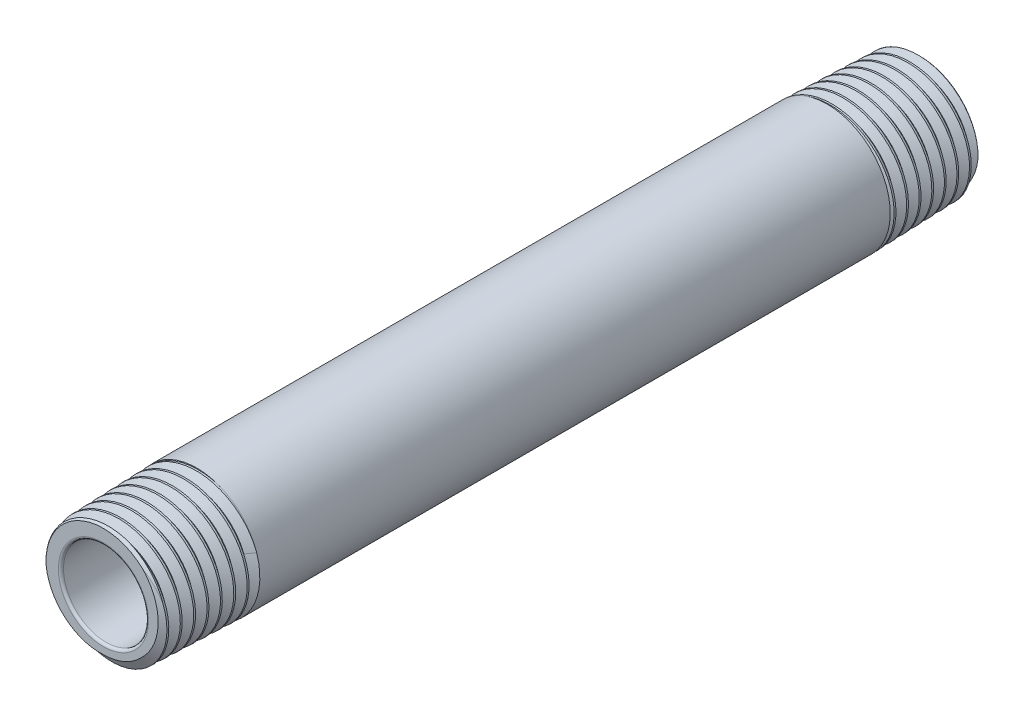
from build123d import *

# Parameters (mm, degrees)
CHAMFER1_SIZE       = 0.2794
CHAMFER1_SIZE2      = 0.28851844
FILLET1_R           = 0.2794
SKETCH6_R           = 6.858
BOSS_EXTRUDE1_DEPTH = 10.16
BOSS_EXTRUDE1_TAPER = 60
SKETCH7_R           = 4.6228
CUT_EXTRUDE1_DEPTH  = 46.495789252
CIRPATTERN1_COUNT   = 2


with BuildPart() as part:
    # Sketch3 → Revolve1 (revolve)
    with BuildSketch(Plane(origin=(0, 0, 0), x_dir=(0, 0, -1), z_dir=(1, 0, 0)), mode=Mode.PRIVATE) as revolve1_sk:
        Polygon((-44.45, 6.541667453), (-34.29, 6.858), (0, 6.858), (0, 4.6228), (-44.45, 4.6228), align=None)
    revolve(revolve1_sk.sketch.rotate(Axis((0, 0, 44.45), (0, 0, -1)), 90), axis=Axis((0, 0, 44.45), (0, 0, -1)))

    # Chamfer1
    chamfer1_edges = [part.edges().sort_by_distance(p)[0] for p in [
        (-6.541667453, 0, 44.45),
    ]]
    chamfer1_side = [part.faces().sort_by_distance(p)[0] for p in [
        (-6.699833727, 0, 39.37),
    ]]
    chamfer(chamfer1_edges, length=CHAMFER1_SIZE, length2=CHAMFER1_SIZE2, reference=chamfer1_side[0])

    # Fillet1
    fillet1_edges = [part.edges().sort_by_distance(p)[0] for p in [
        (-4.6228, 0, 44.45),
    ]]
    fillet(fillet1_edges, radius=FILLET1_R)

    # Mirror1: part across plane


with BuildPart() as part_1:
    add(part.part)
    add(part.part.mirror(Plane.XY))

    # SurfaceCut1
    split(bisect_by=Plane.XY, keep=Keep.TOP)


with BuildPart() as body_2:
    # Split1: the piece on the far side of the plane
    add(part_1.part)
    split(bisect_by=Plane.XY.offset(34.29), keep=Keep.BOTTOM)


with BuildPart() as part_2:
    add(part_1.part)

    # Split1
    split(bisect_by=Plane.XY.offset(34.29), keep=Keep.TOP)

    # Cut-Sweep1: sweep along a curve in space
    with BuildLine() as cut_sweep1_path:
        add(Edge.make_bspline(
            [(0, 6.541667453, 44.45), (0.877709824, 6.54260565, 44.419866898), (1.755426188, 6.36454889, 44.389733796), (3.371979301, 5.678320114, 44.329467593), (4.110112963, 5.170443033, 44.299334491), (5.329171692, 3.905254079, 44.239068287), (5.809565174, 3.148489228, 44.208935185), (6.435843944, 1.506162618, 44.148668981), (6.581454305, 0.621312709, 44.11853588), (6.514293191, -1.13584603, 44.058269676), (6.301547631, -2.007391876, 44.028136574), (5.551090642, -3.598488528, 43.96787037), (5.013702082, -4.317347184, 43.937737269), (3.699370211, -5.487801762, 43.877471065), (2.922995349, -5.938887116, 43.847337963), (1.254483374, -6.501167347, 43.787071759), (0.363069598, -6.612115039, 43.756938657), (-1.393109508, -6.475782942, 43.696672454), (-2.257112152, -6.228559105, 43.666539352), (-3.820197564, -5.414816609, 43.606273148), (-4.518600229, -4.848648353, 43.576140046), (-5.63846858, -3.487042596, 43.515873843), (-6.059445575, -2.692194167, 43.485740741), (-6.556635396, -0.999994035, 43.425474537), (-6.632629256, -0.103376076, 43.395341435), (-6.427099903, 1.649096883, 43.335075231), (-6.145662696, 2.504190681, 43.30494213), (-5.269679132, 4.036744925, 43.244675926), (-4.67551026, 4.713538412, 43.214542824), (-3.268579627, 5.780910407, 43.15427662), (-2.456426715, 6.171022937, 43.124143519), (-0.743081048, 6.602128049, 43.063877315), (0.15736866, 6.642930322, 43.033744213), (1.903405405, 6.368285053, 42.973478009), (2.748233908, 6.05295354, 42.943344907), (4.24777596, 5.115873787, 42.883078704), (4.901836774, 4.494529623, 42.852945602), (5.914877466, 3.044300325, 42.792679398), (6.273414878, 2.21604294, 42.762546296), (6.637540441, 0.484135954, 42.702280093), (6.642967332, -0.418762418, 42.672146991), (6.299395332, -2.155633579, 42.611880787), (5.950542417, -2.988851685, 42.581747685), (4.953610351, -4.452943436, 42.521481481), (4.305961329, -5.083179628, 42.49134838), (2.814533876, -6.040132368, 42.431082176), (1.971401186, -6.366430729, 42.400949074), (0.223554795, -6.662783093, 42.34068287), (-0.680400632, -6.632705236, 42.310549769), (-2.405381798, -6.22050361, 42.250283565), (-3.225657894, -5.838555639, 42.220150463), (-4.651908099, -4.783112521, 42.159884259), (-5.25726108, -4.110072979, 42.129751157), (-6.156450528, -2.579619152, 42.069484954), (-6.449893819, -1.722867659, 42.039351852), (-6.67778211, 0.038262492, 41.979085648), (-6.612124955, 0.941876983, 41.948952546), (-6.131698625, 2.652252983, 41.888686343), (-5.717134899, 3.458271065, 41.858553241), (-4.604617611, 4.84433924, 41.798287037), (-3.90714451, 5.423785548, 41.768153935), (-2.339904207, 6.263620563, 41.707887731), (-1.470815879, 6.523641801, 41.67775463), (0.30091269, 6.682479344, 41.617488426), (1.202784035, 6.581223457, 41.587355324), (2.895853203, 6.033084895, 41.52708912), (3.686314989, 5.586437102, 41.496956019), (5.029915236, 4.418376226, 41.436689815), (5.58246825, 3.697467799, 41.406556713), (6.361444662, 2.095745767, 41.346290509), (6.587526952, 1.215626119, 41.316157407), (6.676832539, -0.563989923, 41.255891204), (6.540013822, -1.462713871, 41.225758102), (5.924782611, -3.135792311, 41.165491898), (5.446634168, -3.909419327, 41.135358796), (4.224651908, -5.208324087, 41.075092593), (3.481346242, -5.733035696, 41.044959491), (1.847508697, -6.449738943, 40.984693287), (0.957684834, -6.641416456, 40.954560185), (-0.827086282, -6.660815453, 40.894293981), (-1.721258724, -6.488525269, 40.86416088), (-3.371684567, -5.806927495, 40.803894676), (-4.127220207, -5.297912817, 40.773761574), (-5.379263938, -4.023720777, 40.71349537), (-5.875226147, -3.259094322, 40.683362269), (-6.528333789, -1.595565458, 40.623096065), (-6.685192659, -0.697384073, 40.592962963), (-6.634417948, 1.089792458, 40.532696759), (-6.426803167, 1.978011621, 40.502563657), (-5.679670645, 3.603149251, 40.442297454), (-5.140474318, 4.339360818, 40.412164352), (-3.815871127, 5.542443584, 40.351898148), (-3.031037147, 6.008790068, 40.321765046), (-1.340295547, 6.597074161, 40.261498843), (-0.435120885, 6.718753304, 40.231365741), (1.35169838, 6.597646062, 40.171099537), (2.232567026, 6.354909017, 40.140966435), (3.829811285, 5.543178344, 40.080700231), (4.545491993, 4.974534231, 40.05056713), (5.697582959, 3.601403025, 39.990300926), (6.133490558, 2.797509982, 39.960167824), (6.655819886, 1.082084927, 39.89990162), (6.742011744, 0.171296711, 39.869768519), (6.550522053, -1.612393852, 39.809502315), (6.272920411, -2.484521474, 39.779369213), (5.397631855, -4.051301832, 39.719103009), (4.800322108, -4.745272777, 39.688969907), (3.380627875, -5.844413619, 39.628703704), (2.558857751, -6.249103764, 39.598570602), (0.821325443, -6.704445931, 39.538304398), (-0.093683227, -6.754897128, 39.508171296), (-1.871469198, -6.493084415, 39.447905093), (-2.733474212, -6.180930959, 39.417771991), (-4.267258899, -5.243227181, 39.357505787), (-4.938370996, -4.618081188, 39.327372685), (-5.982679194, -3.153867968, 39.267106481), (-6.355419274, -2.315434535, 39.23697338), (-6.742842643, -0.558414226, 39.176707176), (-6.757354565, 0.35941055, 39.146574074), (-6.425387878, 2.128515906, 39.08630787), (-6.0790502, 2.979027841, 39.056174769), (-5.080174809, 4.477327926, 38.995908565), (-4.428068052, 5.124463798, 38.965775463), (-2.921456015, 6.112135833, 38.905509259), (-2.067603042, 6.452240491, 38.875376157), (-0.293753093, 6.770915978, 38.815109954), (0.625474352, 6.749345262, 38.784976852), (2.383127268, 6.347503366, 38.724710648), (3.220788941, 5.96740348, 38.694577546), (4.681162363, 4.908699432, 38.634311343), (5.303238195, 4.230552272, 38.604178241), (6.232552626, 2.683734657, 38.543912037), (6.539384986, 1.815734071, 38.513778935), (6.788587694, 0.027747927, 38.453512731), (6.730846637, -0.891461835, 38.42337963), (6.259517949, -2.634899027, 38.363113426), (5.846131809, -3.458368707, 38.332980324), (4.729039636, -4.878424244, 38.27271412), (4.025816031, -5.474391586, 38.242581019), (2.441055964, -6.343712008, 38.182314815), (1.560205954, -6.616684832, 38.152181713), (-0.239191941, -6.795795529, 38.091915509), (-1.156958949, -6.701852412, 38.061782407), (-2.883430018, -6.161534754, 38.001516204), (-3.691383572, -5.715391691, 37.971383102), (-5.068784741, -4.541447578, 37.911116898), (-5.637632261, -3.814153717, 37.880983796), (-6.445410146, -2.193780911, 37.820717593), (-6.683986916, -1.301403992, 37.790584491), (-6.79249335, 0.506654363, 37.730318287), (-6.662372668, 1.421551037, 37.700185185), (-6.053672855, 3.128322804, 37.639918981), (-5.57535493, 3.919455822, 37.60978588), (-4.346188632, 5.25192471, 37.549519676), (-3.595871507, 5.792679897, 37.519386574), (-1.942278846, 6.537457302, 37.45912037), (-1.039719873, 6.74115322, 37.428987269), (0.774225013, 6.778651278, 37.368721065), (1.684823482, 6.612433893, 37.338587963), (3.369184312, 5.936067146, 37.278321759), (4.142214209, 5.426208412, 37.248188657), (5.427535223, 4.14354102, 37.187922454), (5.939266033, 3.371286925, 37.157789352), (6.619678173, 1.686926936, 37.097523148), (6.788061097, 0.775551078, 37.067390046), (6.754255787, -1.041488025, 37.007123843), (6.552078985, -1.946362356, 36.976990741), (5.808868172, -3.605626463, 36.916724537), (5.268153858, -4.359294555, 36.886591435), (3.933795415, -5.595318085, 36.826325231), (3.140728382, -6.07713453, 36.79619213), (1.428109601, -6.691912219, 36.735925926), (0.509300279, -6.824603505, 36.705792824), (-1.308026642, -6.719309782, 36.64552662), (-2.205755072, -6.481367245, 36.615393519), (-3.837266799, -5.672241951, 36.555127315), (-4.570340344, -5.101407562, 36.524994213), (-5.754986337, -3.717254528, 36.464728009), (-6.206042014, -2.904534693, 36.434594907), (-6.754013957, -1.166217939, 36.374328704), (-6.85068923, -0.241374724, 36.344195602), (-6.673832643, 1.573423863, 36.283929398), (-6.400374334, 2.462591036, 36.253796296), (-5.526369763, 4.063729095, 36.193530093), (-4.926200094, 4.775003303, 36.163396991), (-3.494232673, 5.90626474, 36.103130787), (-2.663054587, 6.325758293, 36.072997685), (-0.901649134, 6.805853243, 36.012731481), (0.027814386, 6.866243079, 35.98259838), (1.837263098, 6.617860253, 35.922332176), (2.71646229, 6.30919221, 35.892199074), (4.284643971, 5.371447914, 35.83193287), (4.972943979, 4.74277599, 35.801799769), (6.048890247, 3.265055312, 35.741533565), (6.436066767, 2.41664619, 35.711400463), (6.84731552, 0.63480585, 35.651134259), (6.871206049, -0.297852524, 35.621001157), (6.551444993, -2.099128822, 35.560734954), (6.207929035, -2.966964167, 35.530601852), (5.20768748, -4.499649494, 35.470335648), (4.551393413, -5.163832297, 35.440202546), (3.030058583, -6.18261245, 35.379936343), (2.165676493, -6.536764808, 35.349803241), (0.366095625, -6.878302053, 35.289537037), (-0.568322481, -6.865535475, 35.259403935), (-2.358607226, -6.474655714, 35.199137731), (-3.213695933, -6.096709059, 35.16900463), (-4.708391767, -5.035314021, 35.108738426), (-5.347348104, -4.352323791, 35.078605324), (-6.30719402, -2.789588808, 35.01833912), (-6.627664123, -1.910520807, 34.988206019), (-6.898730131, -0.095930242, 34.927939815), (-6.849205145, 0.838805009, 34.897806713), (-6.387577683, 2.615286874, 34.837540509), (-5.975672477, 3.456261422, 34.807407407), (-4.85456728, 4.91052551, 34.747141204), (-4.145851438, 5.523181708, 34.717008102), (-2.544001979, 6.422411112, 34.656741898), (-1.651562206, 6.708591095, 34.626608796), (0.175274896, 6.908533253, 34.566342593), (1.108879468, 6.8222054, 34.536209491), (2.868759351, 6.290312501, 34.475943287), (3.694269681, 5.844975265, 34.445810185), (5.105714628, 4.665700847, 34.385543981), (5.691034394, 3.932273148, 34.35541088), (6.52805377, 2.293663241, 34.295144676), (6.779387103, 1.389190947, 34.265011574), (6.90766128, -0.447101409, 34.20474537), (6.784543198, -1.378124484, 34.174612269), (6.182977999, -3.118619916, 34.114346065), (5.704788981, -3.927335589, 34.084212963), (4.468981813, -5.293632768, 34.023946759), (3.711897774, -5.850618927, 33.993813657), (2.03894634, -6.623926289, 33.933547454), (1.123803885, -6.839908819, 33.903414352), (-0.719128585, -6.896080569, 33.843148148), (-1.646118601, -6.736242158, 33.813015046), (-3.364468147, -6.065708105, 33.752748843), (-4.155080486, -5.555300548, 33.722615741), (-5.47396386, -4.264690389, 33.662349537), (-6.00166004, -3.485045778, 33.632216435), (-6.709847577, -1.780233075, 33.571950231), (-6.890028481, -0.855803872, 33.54181713), (-6.873774076, 0.990934029, 33.481550926), (-6.677342578, 1.912440949, 33.451417824), (-5.938652687, 3.605908578, 33.39115162), (-5.396712016, 4.377132781, 33.361018519), (-4.053119517, 5.646402645, 33.300752315), (-3.252048772, 6.143894902, 33.270619213), (-1.517912718, 6.78565148, 33.210353009), (-0.585599148, 6.929634143, 33.180219907), (1.26209432, 6.84074144, 33.119953704), (2.176671897, 6.607901424, 33.089820602), (3.842551341, 5.801977365, 33.029554398), (4.593128564, 5.229240287, 32.999421296), (5.810655191, 3.834574444, 32.939155093), (6.277073568, 3.013249031, 32.909021991), (6.564130329, 2.132815233, 32.878888889)],
            knots=[0, 0, 0, 0, 0.0078125, 0.0078125, 0.015625, 0.015625, 0.0234375, 0.0234375, 0.03125, 0.03125, 0.0390625, 0.0390625, 0.046875, 0.046875, 0.0546875, 0.0546875, 0.0625, 0.0625, 0.0703125, 0.0703125, 0.078125, 0.078125, 0.0859375, 0.0859375, 0.09375, 0.09375, 0.1015625, 0.1015625, 0.109375, 0.109375, 0.1171875, 0.1171875, 0.125, 0.125, 0.1328125, 0.1328125, 0.140625, 0.140625, 0.1484375, 0.1484375, 0.15625, 0.15625, 0.1640625, 0.1640625, 0.171875, 0.171875, 0.1796875, 0.1796875, 0.1875, 0.1875, 0.1953125, 0.1953125, 0.203125, 0.203125, 0.2109375, 0.2109375, 0.21875, 0.21875, 0.2265625, 0.2265625, 0.234375, 0.234375, 0.2421875, 0.2421875, 0.25, 0.25, 0.2578125, 0.2578125, 0.265625, 0.265625, 0.2734375, 0.2734375, 0.28125, 0.28125, 0.2890625, 0.2890625, 0.296875, 0.296875, 0.3046875, 0.3046875, 0.3125, 0.3125, 0.3203125, 0.3203125, 0.328125, 0.328125, 0.3359375, 0.3359375, 0.34375, 0.34375, 0.3515625, 0.3515625, 0.359375, 0.359375, 0.3671875, 0.3671875, 0.375, 0.375, 0.3828125, 0.3828125, 0.390625, 0.390625, 0.3984375, 0.3984375, 0.40625, 0.40625, 0.4140625, 0.4140625, 0.421875, 0.421875, 0.4296875, 0.4296875, 0.4375, 0.4375, 0.4453125, 0.4453125, 0.453125, 0.453125, 0.4609375, 0.4609375, 0.46875, 0.46875, 0.4765625, 0.4765625, 0.484375, 0.484375, 0.4921875, 0.4921875, 0.5, 0.5, 0.5078125, 0.5078125, 0.515625, 0.515625, 0.5234375, 0.5234375, 0.53125, 0.53125, 0.5390625, 0.5390625, 0.546875, 0.546875, 0.5546875, 0.5546875, 0.5625, 0.5625, 0.5703125, 0.5703125, 0.578125, 0.578125, 0.5859375, 0.5859375, 0.59375, 0.59375, 0.6015625, 0.6015625, 0.609375, 0.609375, 0.6171875, 0.6171875, 0.625, 0.625, 0.6328125, 0.6328125, 0.640625, 0.640625, 0.6484375, 0.6484375, 0.65625, 0.65625, 0.6640625, 0.6640625, 0.671875, 0.671875, 0.6796875, 0.6796875, 0.6875, 0.6875, 0.6953125, 0.6953125, 0.703125, 0.703125, 0.7109375, 0.7109375, 0.71875, 0.71875, 0.7265625, 0.7265625, 0.734375, 0.734375, 0.7421875, 0.7421875, 0.75, 0.75, 0.7578125, 0.7578125, 0.765625, 0.765625, 0.7734375, 0.7734375, 0.78125, 0.78125, 0.7890625, 0.7890625, 0.796875, 0.796875, 0.8046875, 0.8046875, 0.8125, 0.8125, 0.8203125, 0.8203125, 0.828125, 0.828125, 0.8359375, 0.8359375, 0.84375, 0.84375, 0.8515625, 0.8515625, 0.859375, 0.859375, 0.8671875, 0.8671875, 0.875, 0.875, 0.8828125, 0.8828125, 0.890625, 0.890625, 0.8984375, 0.8984375, 0.90625, 0.90625, 0.9140625, 0.9140625, 0.921875, 0.921875, 0.9296875, 0.9296875, 0.9375, 0.9375, 0.9453125, 0.9453125, 0.953125, 0.953125, 0.9609375, 0.9609375, 0.96875, 0.96875, 0.9765625, 0.9765625, 0.984375, 0.984375, 0.9921875, 0.9921875, 1, 1, 1, 1], degree=3))
    # Sketch4 → Cut-Sweep1 (sweep, cut)
    with BuildSketch(Plane(origin=(0, 0, 0), x_dir=(0, 0, -1), z_dir=(1, 0, 0))):
        Polygon((-45.155555556, 5.625123901), (-44.979166667, 5.625123901), (-44.361805556, 6.694424712), (-45.728819444, 6.618046082), align=None)
    sweep(path=cut_sweep1_path.line, is_frenet=True, mode=Mode.SUBTRACT)

    add(body_2.part)  # Boss-Extrude1 merges body 2
    # Sketch6 → Boss-Extrude1 (add, through all)
    with BuildSketch(Plane.XY.offset(34.29)):
        Circle(SKETCH6_R)
    extrude(amount=BOSS_EXTRUDE1_DEPTH, taper=BOSS_EXTRUDE1_TAPER)

    # Sketch7 → Cut-Extrude1 (cut, through all)
    with BuildSketch(Plane.XY):
        Circle(SKETCH7_R)
    extrude(amount=CUT_EXTRUDE1_DEPTH, mode=Mode.SUBTRACT)


with BuildPart() as cirpattern1_1:
    # CirPattern1: pattern copy
    add(part_2.part.rotate(Axis((0, 6.858, 0), (0, -1, 0)), 1 * 360 / CIRPATTERN1_COUNT))

    # Combine2: union part
    add(part_2.part)


solid = cirpattern1_1.part
